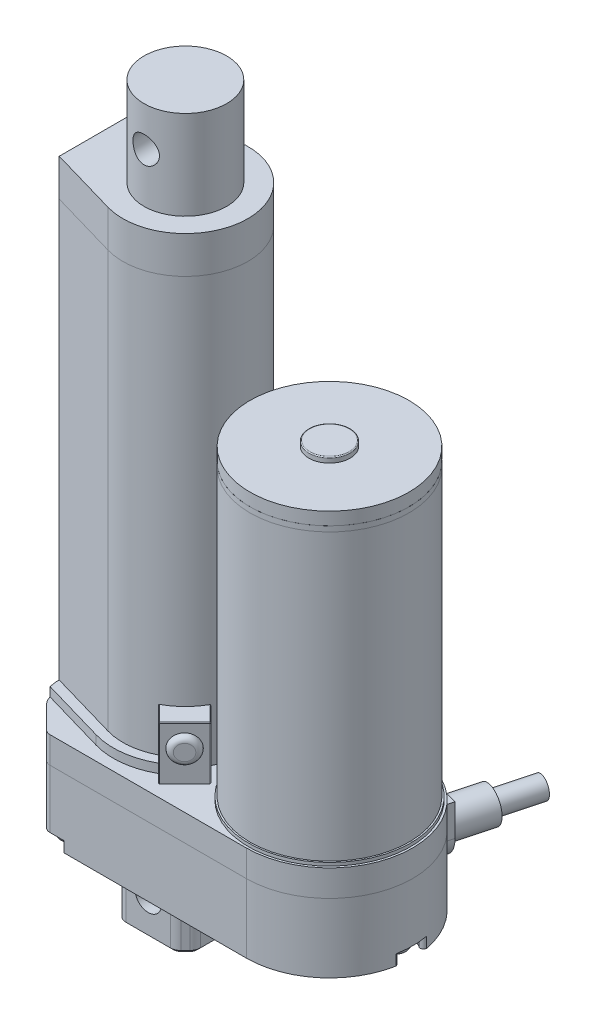
from build123d import *

# Parameters (mm, degrees)
BOSS_EXTRUDE1_DEPTH      = 6.35
SKETCH6_R                = 19.431
BOSS_EXTRUDE4_DEPTH      = 0.762
SKETCH7_R                = 19.05
BOSS_EXTRUDE5_DEPTH      = 68.326
FILLET6_R                = 5.08
FILLET7_R                = 1.905
BOSS_EXTRUDE15_DEPTH     = 6.35
SKETCH24_R               = 4.064
BOSS_EXTRUDE16_DEPTH     = 10.16
SKETCH25_R               = 2.54
BOSS_EXTRUDE17_DEPTH     = 10.16
BOSS_EXTRUDE19_DEPTH     = 16.51
FILLET13_R               = 1.905
FILLET14_R               = 5.08
BOSS_EXTRUDE20_DEPTH     = 18.796
CHAMFER1_SIZE            = 2.54
FILLET15_R               = 2.54
CHAMFER2_SIZE            = 0.762
SKETCH27_R               = 3.175
CUT_EXTRUDE3_DEPTH       = 19.05
SKETCH28_R               = 19.05
BOSS_EXTRUDE22_DEPTH     = 1.27
SKETCH29_R               = 19.05
BOSS_EXTRUDE24_DEPTH     = 3.048
BOSS_EXTRUDE25_START     = 4.318
SKETCH8_R                = 4.953
BOSS_EXTRUDE25_DEPTH     = 1.27
FILLET16_R               = 0.2286
BOSS_EXTRUDE26_DEPTH     = 101.981
BOSS_EXTRUDE27_DEPTH     = 8.89
SKETCH33_R               = 9.906
BOSS_EXTRUDE28_DEPTH     = 21.336
BOSS_EXTRUDE30_DEPTH     = 2.159
BOSS_EXTRUDE31_DEPTH     = 2.159
BOSS_EXTRUDE33_DEPTH     = 12.7
BOSS_EXTRUDE33_2_DEPTH   = 12.7
FILLET17_R               = 0.2286
FILLET18_R               = 0.2286
SKETCH43_R               = 3.175
BOSS_EXTRUDE34_DEPTH     = 1.27
FILLET19_R               = 1.27
SKETCH44_R               = 3.175
BOSS_EXTRUDE35_DEPTH     = 1.27
FILLET20_R               = 1.27
CUT_EXTRUDE5_START       = -2.54
CUT_EXTRUDE5_DEPTH       = 2.54
CUT_EXTRUDE6_START       = -2.54
CUT_EXTRUDE6_DEPTH       = 2.54
SKETCH47_R               = 2.54
BOSS_EXTRUDE36_DEPTH     = 2.54
BOSS_EXTRUDE36_2_DEPTH   = 2.54
BOSS_EXTRUDE36_3_DEPTH   = 2.54
FILLET22_R               = 1.524
FILLET23_R               = 1.524
SKETCH48_R               = 3.81
BOSS_EXTRUDE37_DEPTH     = 1.524
FILLET24_R               = 1.524
FILLET25_R               = 1.524
SKETCH49_R               = 3.81
CUT_EXTRUDE7_DEPTH       = 2.54
SKETCH50_R               = 3.556
BOSS_EXTRUDE39_DEPTH     = 2.54
CUT_EXTRUDE11_DEPTH      = 166.213624927
CUT_EXTRUDE11_DEPTH_BACK = 166.213624927
SKETCH52_R               = 3.175


with BuildPart() as part:
    # Sketch1 → Boss-Extrude1 (new body)
    with BuildSketch(Plane(origin=(0, 0, 0), x_dir=(1, 0, 0), z_dir=(0, 1, 0))):
        with BuildLine():
            Line((0, 32.639), (7.239, 39.878))
            Line((7.239, 39.878), (55.118, 39.878))
            ThreePointArc((55.118, 39.878), (75.057, 19.939), (55.118, 0))
            Line((55.118, 0), (7.239, 0))
            Line((7.239, 0), (0, 7.239))
            Line((0, 7.239), (0, 32.639))
        make_face()
    extrude(amount=BOSS_EXTRUDE1_DEPTH)

    # Fillet6
    fillet6_edges = [part.edges().sort_by_distance(p)[0] for p in [
        (0, 3.175, -7.239),
        (0, 3.175, -32.639),
    ]]
    fillet(fillet6_edges, radius=FILLET6_R)

    # Fillet7
    fillet7_edges = [part.edges().sort_by_distance(p)[0] for p in [
        (7.239, 3.175, 0),
        (7.239, 3.175, -39.878),
    ]]
    fillet(fillet7_edges, radius=FILLET7_R)


with BuildPart() as body_2:
    # Sketch6 → Boss-Extrude4 (new body)
    with BuildSketch(Plane(origin=(0, 6.35, 0), x_dir=(1, 0, 0), z_dir=(0, 1, 0))):
        with Locations(Location((55.118, 19.939, 0), (0, 0, 90))):
            Circle(SKETCH6_R)
    extrude(amount=BOSS_EXTRUDE4_DEPTH)


with BuildPart() as body_3:
    # Sketch7 → Boss-Extrude5 (new body)
    with BuildSketch(Plane(origin=(0, 7.112, 0), x_dir=(1, 0, 0), z_dir=(0, 1, 0))):
        with Locations(Location((55.118, 19.939, 0), (0, 0, 270))):
            Circle(SKETCH7_R)
    extrude(amount=BOSS_EXTRUDE5_DEPTH)


with BuildPart() as body_4:
    # Sketch23 → Boss-Extrude15 (new body)
    with BuildSketch(Plane(origin=(12.522748088, 0, -46.735532116), x_dir=(0, -1, 0), z_dir=(0.25881904510252135, 0, -0.9659258262890681))):
        with BuildLine():
            Line((-2.032, -53.883866243), (5.588, -53.883866243))
            ThreePointArc((5.588, -53.883866243), (11.303, -48.168866243), (5.588, -42.453866243))
            Line((5.588, -42.453866243), (-2.032, -42.453866243))
            Line((-2.032, -42.453866243), (-2.032, -53.883866243))
        make_face()
    extrude(amount=BOSS_EXTRUDE15_DEPTH)

    # Sketch24 → Boss-Extrude16 (add)
    with BuildSketch(Plane(origin=(14.166249025, 0, -52.869161113), x_dir=(-0.9659258262890682, 0, -0.25881904510252135), z_dir=(0.2588190451025213, 0, -0.9659258262890681))):
        with Locations((-48.168866243, -5.588)):
            Circle(SKETCH24_R)
    extrude(amount=BOSS_EXTRUDE16_DEPTH)

    # Sketch25 → Boss-Extrude17 (add)
    with BuildSketch(Plane(origin=(16.795850523, 0, -62.682967508), x_dir=(-0.9659258262890681, 0, -0.25881904510252135), z_dir=(0.25881904510252135, 0, -0.9659258262890681))):
        with Locations((-48.168866243, -5.588)):
            Circle(SKETCH25_R)
    extrude(amount=BOSS_EXTRUDE17_DEPTH)


with BuildPart() as body_5:
    # Sketch1<3> → Boss-Extrude19 (new body)
    with BuildSketch(Plane(origin=(0, 0, 0), x_dir=(1, 0, 0), z_dir=(0, 1, 0))):
        with BuildLine():
            Line((0, 32.639), (7.239, 39.878))
            Line((7.239, 39.878), (55.118, 39.878))
            ThreePointArc((55.118, 39.878), (75.057, 19.939), (55.118, 0))
            Line((55.118, 0), (7.239, 0))
            Line((7.239, 0), (0, 7.239))
            Line((0, 7.239), (0, 32.639))
        make_face()
    extrude(amount=-BOSS_EXTRUDE19_DEPTH)

    # Fillet13
    fillet13_edges = [body_5.edges().sort_by_distance(p)[0] for p in [
        (7.239, -8.255, 0),
        (7.239, -8.255, -39.878),
    ]]
    fillet(fillet13_edges, radius=FILLET13_R)

    # Fillet14
    fillet14_edges = [body_5.edges().sort_by_distance(p)[0] for p in [
        (0, -8.255, -7.239),
        (0, -8.255, -32.639),
    ]]
    fillet(fillet14_edges, radius=FILLET14_R)

    # Sketch45 → Cut-Extrude5 (cut)
    with BuildSketch(Plane.XZ.offset(16.51).offset(CUT_EXTRUDE5_START)):
        with BuildLine():
            ThreePointArc((5.044290367, -35.978344089), (4.718699387, -36.549691761), (4.084467985, -36.723467985))
            Line((4.084467985, -36.723467985), (6.681038418, -39.320038418))
            ThreePointArc((6.681038418, -39.320038418), (7.299064898, -39.732990509), (8.028076836, -39.878))
            Line((8.028076836, -39.878), (11.393838428, -39.878))
            ThreePointArc((11.393838428, -39.878), (11.138454644, -39.419455597), (11.282110896, -38.914632134))
            ThreePointArc((11.282110896, -38.914632134), (10.476958507, -32.531164357), (5.044290367, -35.978344089))
        make_face()
        with BuildLine():
            ThreePointArc((11.282110896, -0.963367866), (11.138454644, -0.458544403), (11.393838428, 0))
            Line((11.393838428, 0), (8.028076836, 0))
            ThreePointArc((8.028076836, 0), (7.299064898, -0.145009491), (6.681038418, -0.557961582))
            Line((6.681038418, -0.557961582), (4.084467985, -3.154532015))
            ThreePointArc((4.084467985, -3.154532015), (4.718699387, -3.328308239), (5.044290367, -3.899655911))
            ThreePointArc((5.044290367, -3.899655911), (10.476958507, -7.346835643), (11.282110896, -0.963367866))
        make_face()
    extrude(amount=CUT_EXTRUDE5_DEPTH, mode=Mode.SUBTRACT)

    # Sketch45<3> → Cut-Extrude6 (cut)
    with BuildSketch(Plane.XZ.offset(16.51).offset(CUT_EXTRUDE6_START)):
        with BuildLine():
            Line((4.084467985, -36.723467985), (6.681038418, -39.320038418))
            ThreePointArc((6.681038418, -39.320038418), (7.299064898, -39.732990509), (8.028076836, -39.878))
            Line((8.028076836, -39.878), (11.393838428, -39.878))
            ThreePointArc((11.393838428, -39.878), (11.138454644, -39.419455597), (11.282110896, -38.914632134))
            ThreePointArc((11.282110896, -38.914632134), (10.476958507, -32.531164357), (5.044290367, -35.978344089))
            ThreePointArc((5.044290367, -35.978344089), (4.718699387, -36.549691761), (4.084467985, -36.723467985))
        make_face()
        with BuildLine():
            Line((11.393838428, 0), (8.028076836, 0))
            ThreePointArc((8.028076836, 0), (7.299064898, -0.145009491), (6.681038418, -0.557961582))
            Line((6.681038418, -0.557961582), (4.084467985, -3.154532015))
            ThreePointArc((4.084467985, -3.154532015), (4.718699387, -3.328308239), (5.044290367, -3.899655911))
            ThreePointArc((5.044290367, -3.899655911), (10.476958507, -7.346835643), (11.282110896, -0.963367866))
            ThreePointArc((11.282110896, -0.963367866), (11.138454644, -0.458544403), (11.393838428, 0))
        make_face()
        with BuildLine():
            ThreePointArc((73.662109712, -16.992248385), (67.437, -19.939), (73.662109712, -22.885751615))
            ThreePointArc((73.662109712, -22.885751615), (74.341584064, -23.041280193), (74.712069674, -23.631716426))
            ThreePointArc((74.712069674, -23.631716426), (75.057, -19.939), (74.712069674, -16.246283574))
            ThreePointArc((74.712069674, -16.246283574), (74.341584064, -16.836719807), (73.662109712, -16.992248385))
        make_face()
    extrude(amount=CUT_EXTRUDE6_DEPTH, mode=Mode.SUBTRACT)


with BuildPart() as body_6:
    # Sketch26 → Boss-Extrude20 (new body)
    with BuildSketch(Plane(origin=(0, -16.51, 0), x_dir=(-1, 0, 0), z_dir=(0, -1, 0))):
        Polygon((-20.574, 28.829), (-11.684, 28.829), (-11.684, 11.049), (-29.464, 11.049), (-29.464, 28.829), align=None)
    extrude(amount=BOSS_EXTRUDE20_DEPTH)

    # Chamfer1
    chamfer1_edges = [body_6.edges().sort_by_distance(p)[0] for p in [
        (11.684, -25.908, -11.049),
        (29.464, -25.908, -11.049),
        (29.464, -25.908, -28.829),
        (11.684, -25.908, -28.829),
    ]]
    chamfer(chamfer1_edges, length=CHAMFER1_SIZE)

    # Fillet15
    fillet15_edges = [body_6.edges().sort_by_distance(p)[0] for p in [
        (29.464, -25.908, -13.589),
        (29.464, -25.908, -26.289),
        (14.224, -25.908, -28.829),
        (26.924, -25.908, -28.829),
        (14.224, -25.908, -11.049),
        (26.924, -25.908, -11.049),
        (11.684, -25.908, -26.289),
        (11.684, -25.908, -13.589),
    ]]
    fillet(fillet15_edges, radius=FILLET15_R)

    # Chamfer2
    chamfer2_edges = [body_6.edges().sort_by_distance(p)[0] for p in [
        (11.684, -35.306, -19.939),
        (12.954, -35.306, -12.319),
        (20.574, -35.306, -28.829),
        (28.194, -35.306, -27.559),
        (29.464, -35.306, -19.939),
        (28.194, -35.306, -12.319),
        (20.574, -35.306, -11.049),
        (12.954, -35.306, -27.559),
        (14.30408653, -35.306, -28.635654013),
        (11.877345987, -35.306, -26.20891347),
        (26.84391347, -35.306, -28.635654013),
        (29.270654013, -35.306, -26.20891347),
        (29.270654013, -35.306, -13.66908653),
        (26.84391347, -35.306, -11.242345987),
        (14.30408653, -35.306, -11.242345987),
        (11.877345987, -35.306, -13.66908653),
    ]]
    chamfer(chamfer2_edges, length=CHAMFER2_SIZE)

    # Sketch27 → Cut-Extrude3 (cut)
    with BuildSketch(Plane.XY.offset(-11.049)):
        with Locations((20.574, -26.67)):
            Circle(SKETCH27_R)
    extrude(amount=-CUT_EXTRUDE3_DEPTH, mode=Mode.SUBTRACT)


with BuildPart() as body_7:
    # Sketch28 → Boss-Extrude22 (new body)
    with BuildSketch(Plane(origin=(0, 75.438, 0), x_dir=(1, 0, 0), z_dir=(0, 1, 0))):
        with Locations(Location((55.118, 19.939, 0), (0, 0, 270))):
            Circle(SKETCH28_R)
    extrude(amount=BOSS_EXTRUDE22_DEPTH)


with BuildPart() as body_8:
    # Sketch29 → Boss-Extrude24 (new body)
    with BuildSketch(Plane(origin=(0, 76.708, 0), x_dir=(1, 0, 0), z_dir=(0, 1, 0))):
        with Locations(Location((55.118, 19.939, 0), (0, 0, 90))):
            Circle(SKETCH29_R)
    extrude(amount=BOSS_EXTRUDE24_DEPTH)

    # Sketch8 → Boss-Extrude25 (add)
    with BuildSketch(Plane(origin=(0, 75.438, 0), x_dir=(1, 0, 0), z_dir=(0, 1, 0)).offset(BOSS_EXTRUDE25_START)):
        with Locations(Location((55.118, 19.939, 0), (0, 0, 270))):
            Circle(SKETCH8_R)
    extrude(amount=BOSS_EXTRUDE25_DEPTH)

    # Fillet16
    fillet16_edges = [body_8.edges().sort_by_distance(p)[0] for p in [
        (55.118, 81.026, -24.892),
    ]]
    fillet(fillet16_edges, radius=FILLET16_R)


with BuildPart() as body_9:
    # Sketch15 → Boss-Extrude26 (new body)
    with BuildSketch(Plane(origin=(0, 6.35, 0), x_dir=(1, 0, 0), z_dir=(0, 1, 0))):
        with BuildLine():
            Line((0, 19.939), (0, 10.286870396))
            Line((0, 10.286870396), (16.411980417, 5.54225678))
            ThreePointArc((16.411980417, 5.54225678), (35.560281138, 19.939054609), (16.411875495, 34.335712887))
            Line((16.411875495, 34.335712887), (0, 29.591))
            Line((0, 29.591), (0, 19.939))
        make_face()
    extrude(amount=BOSS_EXTRUDE26_DEPTH)

    # Sketch48 → Boss-Extrude37 (add)
    with BuildSketch(Plane.ZY):
        with Locations(Location((-19.939, 12.7, 0), (0, 0, 180))):
            Circle(SKETCH48_R)
    extrude(amount=BOSS_EXTRUDE37_DEPTH)

    # Fillet24
    fillet24_edges = [body_9.edges().sort_by_distance(p)[0] for p in [
        (-1.524, 12.7, -16.129),
    ]]
    fillet(fillet24_edges, radius=FILLET24_R - 0.0001)  # a hair under: the kernel refuses the full size

    # Sketch49 → Cut-Extrude7 (cut)
    with BuildSketch(Plane.ZY):
        with Locations((-19.938935198, 103.378)):
            Circle(SKETCH49_R)
    extrude(amount=-CUT_EXTRUDE7_DEPTH, mode=Mode.SUBTRACT)

    # Sketch50 → Boss-Extrude39 (add)
    with BuildSketch(Plane.ZY.offset(-2.54)):
        with Locations((-19.938935198, 103.378)):
            Circle(SKETCH50_R)
    extrude(amount=BOSS_EXTRUDE39_DEPTH)


with BuildPart() as body_10:
    # Sketch32 → Boss-Extrude27 (new body)
    with BuildSketch(Plane(origin=(0, 108.331, 0), x_dir=(1, 0, 0), z_dir=(0, 1, 0))):
        with BuildLine():
            Line((0, 10.286870396), (0, 29.591))
            Line((0, 29.591), (16.411875495, 34.335712887))
            ThreePointArc((16.411875495, 34.335712887), (35.560281138, 19.939054609), (16.411980417, 5.54225678))
            Line((16.411980417, 5.54225678), (0, 10.286870396))
        make_face()
    extrude(amount=BOSS_EXTRUDE27_DEPTH)

    # Sketch33 → Boss-Extrude28 (add)
    with BuildSketch(Plane(origin=(0, 117.221, 0), x_dir=(1, 0, 0), z_dir=(0, 1, 0))):
        with Locations(Location((20.574, 19.939, 0), (0, 0, 270))):
            Circle(SKETCH33_R)
    extrude(amount=BOSS_EXTRUDE28_DEPTH)

    # Sketch52 → Cut-Extrude11 (cut, two sides: drawn at the far end of the back side and taken through both)
    with BuildSketch(Plane.XY.offset(-11.049).offset(-CUT_EXTRUDE11_DEPTH_BACK)):
        with Locations(Location((20.574, 129.032, 0), (0, 0, 89.99999999))):
            Circle(SKETCH52_R)
    extrude(amount=CUT_EXTRUDE11_DEPTH + CUT_EXTRUDE11_DEPTH_BACK, mode=Mode.SUBTRACT)


with BuildPart() as body_11:
    # Sketch41 → Boss-Extrude30 (new body)
    with BuildSketch(Plane(origin=(0, 6.35, 0), x_dir=(1, 0, 0), z_dir=(0, 1, 0))):
        with BuildLine():
            Line((0, 29.591), (16.411875495, 34.335712887))
            ThreePointArc((16.411875495, 34.335712887), (22.021175201, 34.855243035), (27.425990452, 33.267122493))
            Line((27.425990452, 33.267122493), (29.11221422, 34.953346261))
            ThreePointArc((29.11221422, 34.953346261), (22.604273469, 37.091541659), (15.776987058, 36.531780434))
            Line((15.776987058, 36.531780434), (0.2736806, 32.049737053))
            Line((0.2736806, 32.049737053), (0, 30.534795103))
            Line((0, 30.534795103), (0, 29.591))
        make_face()
    extrude(amount=BOSS_EXTRUDE30_DEPTH)


with BuildPart() as body_12:
    # Sketch41<11> → Boss-Extrude31 (new body)
    with BuildSketch(Plane(origin=(0, 6.35, 0), x_dir=(1, 0, 0), z_dir=(0, 1, 0))):
        with BuildLine():
            Line((16.411875495, 5.542157508), (0, 10.286870396))
            Line((0, 10.286870396), (0, 9.343204897))
            Line((0, 9.343204897), (0, 9.343075292))
            Line((0, 9.343075292), (0.2736806, 7.828133343))
            Line((0.2736806, 7.828133343), (15.776987058, 3.346089961))
            ThreePointArc((15.776987058, 3.346089961), (22.604273469, 2.786328737), (29.11221422, 4.924524135))
            Line((29.11221422, 4.924524135), (27.425990452, 6.610747903))
            ThreePointArc((27.425990452, 6.610747903), (22.021175201, 5.02262736), (16.411875495, 5.542157508))
        make_face()
    extrude(amount=BOSS_EXTRUDE31_DEPTH)


with BuildPart() as body_13:
    # Sketch41<12> → Boss-Extrude33 (new body)
    with BuildSketch(Plane(origin=(0, 6.35, 0), x_dir=(1, 0, 0), z_dir=(0, 1, 0))):
        with BuildLine():
            Line((29.11221422, 34.953346261), (27.425990452, 33.267122493))
            ThreePointArc((27.425990452, 33.267122493), (31.070982239, 30.634886416), (33.77116823, 27.039941701))
            Line((33.77116823, 27.039941701), (37.542875801, 30.811649272))
            Line((37.542875801, 30.811649272), (31.256696516, 37.097828557))
            Line((31.256696516, 37.097828557), (29.11221422, 34.953346261))
        make_face()
    extrude(amount=BOSS_EXTRUDE33_DEPTH)

    # Fillet17
    fillet17_edges = [body_13.edges().sort_by_distance(p)[0] for p in [
        (35.657022016, 19.05, -28.925795487),
        (34.399786159, 19.05, -33.954738915),
        (29.341343484, 19.05, -35.182475525),
        (31.256696516, 12.7, -37.097828557),
        (37.542875801, 12.7, -30.811649272),
    ]]
    fillet(fillet17_edges, radius=FILLET17_R)


with BuildPart() as body_14:
    # Sketch41<12> → Boss-Extrude33 2 (new body)
    with BuildSketch(Plane(origin=(0, 6.35, 0), x_dir=(1, 0, 0), z_dir=(0, 1, 0))):
        with BuildLine():
            Line((31.256696516, 2.780041839), (37.542875801, 9.066221123))
            Line((37.542875801, 9.066221123), (33.77116823, 12.837928694))
            ThreePointArc((33.77116823, 12.837928694), (31.070982239, 9.24298398), (27.425990452, 6.610747903))
            Line((27.425990452, 6.610747903), (29.11221422, 4.924524135))
            Line((29.11221422, 4.924524135), (31.256696516, 2.780041839))
        make_face()
    extrude(amount=BOSS_EXTRUDE33_2_DEPTH)

    # Fillet18
    fillet18_edges = [body_14.edges().sort_by_distance(p)[0] for p in [
        (34.399786159, 19.05, -5.923131481),
        (35.657022016, 19.05, -10.952074909),
        (29.341343484, 19.05, -4.695394871),
        (37.542875801, 12.7, -9.066221123),
        (31.256696516, 12.7, -2.780041839),
    ]]
    fillet(fillet18_edges, radius=FILLET18_R)


with BuildPart() as body_15:
    # Sketch43 → Boss-Extrude34 (new body)
    with BuildSketch(Plane(origin=(34.177262537, 0, -34.177262537), x_dir=(-0.7071067811865481, 0, -0.7071067811865469), z_dir=(0.7071067811865469, 0, -0.7071067811865481))):
        with Locations(Location((-0.314695924, 13.7414, 0), (0, 0, 180))):
            Circle(SKETCH43_R)
    extrude(amount=BOSS_EXTRUDE34_DEPTH)

    # Fillet19
    fillet19_edges = [body_15.edges().sort_by_distance(p)[0] for p in [
        (33.052747741, 13.7414, -37.097828557),
    ]]
    fillet(fillet19_edges, radius=FILLET19_R - 0.0001)  # a hair under: the kernel refuses the full size


with BuildPart() as body_16:
    # Sketch44 → Boss-Extrude35 (new body)
    with BuildSketch(Plane(origin=(14.238327339, 0, 14.238327339), x_dir=(0.7071067811865481, 0, -0.7071067811865469), z_dir=(0.7071067811865469, 0, 0.7071067811865481))):
        with Locations(Location((28.5126085, 13.7414, 0), (0, 0, 180))):
            Circle(SKETCH44_R)
    extrude(amount=BOSS_EXTRUDE35_DEPTH)

    # Fillet20
    fillet20_edges = [body_16.edges().sort_by_distance(p)[0] for p in [
        (37.542875801, 13.7414, -7.270169899),
    ]]
    fillet(fillet20_edges, radius=FILLET20_R - 0.0001)  # a hair under: the kernel refuses the full size


with BuildPart() as body_17:
    # Sketch47 → Boss-Extrude36 (new body)
    with BuildSketch(Plane(origin=(0, -13.97, 0), x_dir=(-1, 0, 0), z_dir=(0, -1, 0))):
        with Locations(Location((-8.854290367, 35.978344089, 0), (0, 0, 90))):
            Circle(SKETCH47_R)
    extrude(amount=BOSS_EXTRUDE36_DEPTH)

    # Fillet22
    fillet22_edges = [body_17.edges().sort_by_distance(p)[0] for p in [
        (8.854290367, -16.51, -33.438344089),
    ]]
    fillet(fillet22_edges, radius=FILLET22_R)


with BuildPart() as body_18:
    # Sketch47 → Boss-Extrude36 2 (new body)
    with BuildSketch(Plane(origin=(0, -13.97, 0), x_dir=(-1, 0, 0), z_dir=(0, -1, 0))):
        with Locations(Location((-8.854290367, 3.899655911, 0), (0, 0, 90))):
            Circle(SKETCH47_R)
    extrude(amount=BOSS_EXTRUDE36_2_DEPTH)

    # Fillet23
    fillet23_edges = [body_18.edges().sort_by_distance(p)[0] for p in [
        (8.854290367, -16.51, -1.359655911),
    ]]
    fillet(fillet23_edges, radius=FILLET23_R)


with BuildPart() as body_19:
    # Sketch47 → Boss-Extrude36 3 (new body)
    with BuildSketch(Plane(origin=(0, -13.97, 0), x_dir=(-1, 0, 0), z_dir=(0, -1, 0))):
        with Locations(Location((-71.247, 19.939, 0), (0, 0, 90))):
            Circle(SKETCH47_R)
    extrude(amount=BOSS_EXTRUDE36_3_DEPTH)

    # Fillet25
    fillet25_edges = [body_19.edges().sort_by_distance(p)[0] for p in [
        (71.247, -16.51, -17.399),
    ]]
    fillet(fillet25_edges, radius=FILLET25_R)


solid = Compound([part.part, body_2.part, body_3.part, body_4.part, body_5.part, body_6.part, body_7.part, body_8.part, body_9.part, body_10.part, body_11.part, body_12.part, body_13.part, body_14.part, body_15.part, body_16.part, body_17.part, body_18.part, body_19.part])
